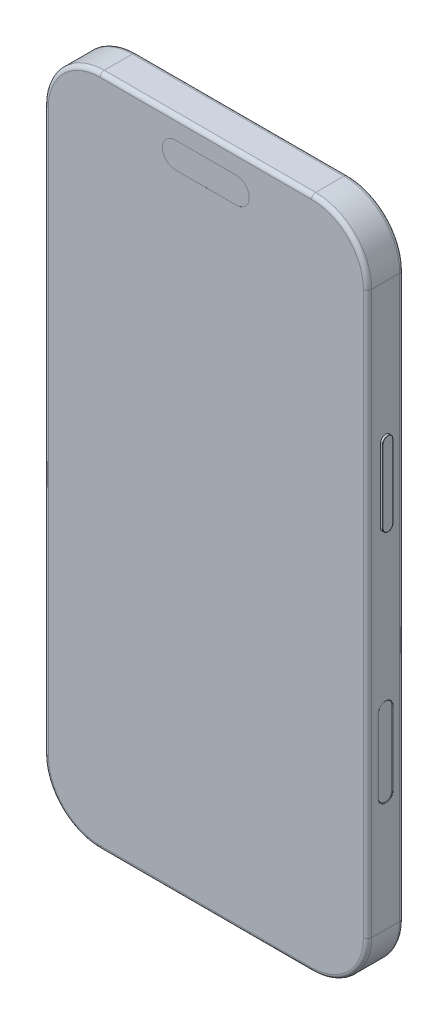
from build123d import *

# Parameters (mm, degrees)
BOSS_EXTRUDE1_DEPTH      = 4.375
FILLET1_R                = 1
CUT_EXTRUDE1_DEPTH       = 0.001
BOSS_EXTRUDE2_DEPTH      = 0.55
CUT_EXTRUDE2_DEPTH       = 0.1
FILLET2_R                = 0.2
FILLET3_R                = 0.1
BOSS_EXTRUDE4_DEPTH      = 0.6
FILLET4_R                = 0.1
SKETCH13_6_R             = 0.8
CUT_EXTRUDE3_DEPTH       = 5
CUT_EXTRUDE4_DEPTH       = 0.01
BOSS_EXTRUDE5_DEPTH      = 2.55
FILLET5_R                = 1.8
SKETCH16_R               = 7.8
BOSS_EXTRUDE6_DEPTH      = 2.2
FILLET6_R                = 0.5
CUT_EXTRUDE5_START       = -6.925
CUT_EXTRUDE5_OUTLINE_R   = 0.575
CUT_EXTRUDE5_DEPTH       = 5
CUT_EXTRUDE6_START       = -6.925
CUT_EXTRUDE6_OUTLINE_R   = 3.325
CUT_EXTRUDE6_OUTLINE_R_2 = 3.4
CUT_EXTRUDE6_DEPTH       = 0.01
SKETCH17_OUTSIDE_W       = 117.382
SKETCH17_OUTSIDE_H       = 200.632
SKETCH17_OUTSIDE_R       = 5.75
CUT_EXTRUDE7_DEPTH       = 0.01
CUT_EXTRUDE8_DEPTH       = 7
CUT_EXTRUDE9_START       = -81.2
CUT_EXTRUDE9_OUTLINE_R   = 0.575
CUT_EXTRUDE9_DEPTH       = 10
SKETCH20_R               = 0.865
CUT_EXTRUDE10_DEPTH      = 10


# Read off the part's stored shape, not the designer's step: Cut-Extrude5, Cut-Extrude6, Cut-Extrude9
with BuildPart() as part:
    # Sketch1 → Boss-Extrude1 (new, symmetric)
    with BuildSketch(Plane.XY):
        with BuildLine():
            Line((-25.5, 81.2), (25.5, 81.2))
            ThreePointArc((25.5, 81.2), (35.045941546, 77.245941546), (39, 67.7))
            Line((39, 67.7), (39, -67.7))
            ThreePointArc((39, -67.7), (35.045941546, -77.245941546), (25.5, -81.2))
            Line((25.5, -81.2), (-25.5, -81.2))
            ThreePointArc((-25.5, -81.2), (-35.045941546, -77.245941546), (-39, -67.7))
            Line((-39, -67.7), (-39, 67.7))
            ThreePointArc((-39, 67.7), (-35.045941546, 77.245941546), (-25.5, 81.2))
        make_face()
    extrude(amount=BOSS_EXTRUDE1_DEPTH, both=True)

    # Fillet1
    fillet1_edges = [part.edges().sort_by_distance(p)[0] for p in [
        (0, 81.2, -4.375),
        (35.045941546, 77.245941546, -4.375),
        (39, 0, -4.375),
        (35.045941546, -77.245941546, -4.375),
        (35.045941546, 77.245941546, 4.375),
        (0, 81.2, 4.375),
        (-35.045941546, 77.245941546, 4.375),
        (-39, 0, 4.375),
        (-35.045941546, -77.245941546, 4.375),
        (0, -81.2, 4.375),
        (35.045941546, -77.245941546, 4.375),
        (0, -81.2, -4.375),
        (39, 0, 4.375),
        (-35.045941546, -77.245941546, -4.375),
        (-39, 0, -4.375),
        (-35.045941546, 77.245941546, -4.375),
    ]]
    fillet(fillet1_edges, radius=FILLET1_R)

    # Sketch4 → Cut-Extrude1 (cut)
    with BuildSketch(Plane.XY.offset(4.375)):
        with BuildLine():
            Line((-7.345, 76.2), (7.345, 76.2))
            ThreePointArc((7.345, 76.2), (10.465, 73.08), (7.345, 69.96))
            Line((7.345, 69.96), (-7.345, 69.96))
            ThreePointArc((-7.345, 69.96), (-10.465, 73.08), (-7.345, 76.2))
        make_face()
    extrude(amount=-CUT_EXTRUDE1_DEPTH, mode=Mode.SUBTRACT)

    # Sketch7 → Boss-Extrude2 (add)
    with BuildSketch(Plane(origin=(39, 0, 0), x_dir=(0, 0, -1), z_dir=(1, 0, 0))):
        with BuildLine():
            Line((1.23, 34.52), (1.23, 16.82))
            ThreePointArc((1.23, 16.82), (0, 15.59), (-1.23, 16.82))
            Line((-1.23, 16.82), (-1.23, 34.52))
            ThreePointArc((-1.23, 34.52), (0, 35.75), (1.23, 34.52))
        make_face()
    extrude(amount=BOSS_EXTRUDE2_DEPTH)

    # Sketch7<3> → Cut-Extrude2 (cut)
    with BuildSketch(Plane(origin=(39, 0, 0), x_dir=(0, 0, -1), z_dir=(1, 0, 0))):
        with BuildLine():
            Line((1.665, -21.77), (1.665, -39.47))
            ThreePointArc((1.665, -39.47), (0, -41.135), (-1.665, -39.47))
            Line((-1.665, -39.47), (-1.665, -21.77))
            ThreePointArc((-1.665, -21.77), (0, -20.105), (1.665, -21.77))
        make_face()
    extrude(amount=-CUT_EXTRUDE2_DEPTH, mode=Mode.SUBTRACT)

    # Fillet2
    # the kernel refuses this fillet: 0.2 mm, written as the material it takes off along each edge
    with BuildSketch(Plane(origin=(39, -21.77, 0), x_dir=(0, 0, 1), z_dir=(0, -1, 0))) as fillet2_piece_1:
        with BuildLine():
            CenterArc((1.838205081, 0.2), FILLET2_R, 210, 60)
            Line((1.665, 0.1), (1.661535898, 0.098))
            ThreePointArc((1.661535898, 0.098), (1.661, 0.05), (1.661, 0))
            Line((1.661, 0), (1.665, -0.004))
            Line((1.665, -0.004), (1.838205081, -0.004))
            Line((1.838205081, -0.004), (1.838205081, 0))
        make_face()
    revolve(axis=Axis((39, -21.77, 0), (-1, 0, 0)), revolution_arc=180, mode=Mode.SUBTRACT)
    with BuildSketch(Plane(origin=(39, -39.47, 0), x_dir=(0, 0, -1), z_dir=(0, 1, 0))) as fillet2_piece_2:
        with BuildLine():
            CenterArc((1.838205081, 0.2), FILLET2_R, 210, 60)
            Line((1.665, 0.1), (1.661535898, 0.098))
            ThreePointArc((1.661535898, 0.098), (1.661, 0.05), (1.661, 0))
            Line((1.661, 0), (1.665, -0.004))
            Line((1.665, -0.004), (1.838205081, -0.004))
            Line((1.838205081, -0.004), (1.838205081, 0))
        make_face()
    revolve(axis=Axis((39, -39.47, 0), (-1, 0, 0)), revolution_arc=180, mode=Mode.SUBTRACT)
    with BuildSketch(Plane(origin=(39, -39.47, 1.665), x_dir=(0, 0, 1), z_dir=(0, 1, 0)), Plane(origin=(39, -21.77, -1.665), x_dir=(0, 0, -1), z_dir=(0, -1, 0))) as fillet2_piece_3:
        with BuildLine():
            CenterArc((0.173205081, -0.2), FILLET2_R, 90, 60)
            Line((0, -0.1), (-0.003464102, -0.098))
            ThreePointArc((-0.003464102, -0.098), (-0.004, -0.05), (-0.004, 0))
            Line((-0.004, 0), (0, 0.004))
            Line((0, 0.004), (0.173205081, 0.004))
            Line((0.173205081, 0.004), (0.173205081, 0))
        make_face()
    extrude(amount=17.7, mode=Mode.SUBTRACT)

    # Fillet3
    fillet3_edges = [part.edges().sort_by_distance(p)[0] for p in [
        (39.55, 25.67, -1.23),
        (39.55, 35.75, 0),
        (39.55, 25.67, 1.23),
        (39.55, 15.59, 0),
    ]]
    fillet(fillet3_edges, radius=FILLET3_R)

    # Sketch13 → Boss-Extrude4 (add)
    with BuildSketch(Plane.ZY.offset(39)):
        with BuildLine():
            Line((-1.33, 22.84), (-1.33, 14.3))
            ThreePointArc((-1.33, 14.3), (0, 12.97), (1.33, 14.3))
            Line((1.33, 14.3), (1.33, 22.84))
            ThreePointArc((1.33, 22.84), (0, 24.17), (-1.33, 22.84))
        make_face()
        with BuildLine():
            Line((-1.33, 40.43315417), (-1.33, 31.89315417))
            ThreePointArc((-1.33, 31.89315417), (0, 30.56315417), (1.33, 31.89315417))
            Line((1.33, 31.89315417), (1.33, 40.43315417))
            ThreePointArc((1.33, 40.43315417), (0, 41.76315417), (-1.33, 40.43315417))
        make_face()
        with BuildLine():
            Line((-1.33, 48.99), (-1.33, 44.85))
            ThreePointArc((-1.33, 44.85), (0, 43.52), (1.33, 44.85))
            Line((1.33, 44.85), (1.33, 48.99))
            ThreePointArc((1.33, 48.99), (0, 50.32), (-1.33, 48.99))
        make_face()
    extrude(amount=BOSS_EXTRUDE4_DEPTH)

    # Fillet4
    fillet4_edges = [part.edges().sort_by_distance(p)[0] for p in [
        (-39.6, 18.57, 1.33),
        (-39.6, 18.57, -1.33),
        (-39.6, 12.97, 0),
        (-39.6, 24.17, 0),
        (-39.6, 36.16315417, 1.33),
        (-39.6, 36.16315417, -1.33),
        (-39.6, 30.56315417, 0),
        (-39.6, 41.76315417, 0),
        (-39.6, 46.92, 1.33),
        (-39.6, 46.92, -1.33),
        (-39.6, 43.52, 0),
        (-39.6, 50.32, 0),
    ]]
    fillet(fillet4_edges, radius=FILLET4_R)

    # Sketch13<6> → Cut-Extrude3 (cut)
    with BuildSketch(Plane.ZY.offset(39)):
        with Locations(Location((0, -38.63, 0), (0, 0, 270))):
            Circle(SKETCH13_6_R)
    extrude(amount=-CUT_EXTRUDE3_DEPTH, mode=Mode.SUBTRACT)

    # Sketch14 → Cut-Extrude4 (cut)
    with BuildSketch(Plane(origin=(0, 0, -4.375), x_dir=(-1, 0, 0), z_dir=(0, 0, -1))):
        with BuildLine():
            Line((-23.08, 33.35), (23.08, 33.35))
            ThreePointArc((23.08, 33.35), (32.625941546, 29.395941546), (36.58, 19.85))
            Line((36.58, 19.85), (36.58, -64.45))
            ThreePointArc((36.58, -64.45), (32.625941546, -73.995941546), (23.08, -77.95))
            Line((23.08, -77.95), (-23.08, -77.95))
            ThreePointArc((-23.08, -77.95), (-32.625941546, -73.995941546), (-36.58, -64.45))
            Line((-36.58, -64.45), (-36.58, 19.85))
            ThreePointArc((-36.58, 19.85), (-32.625941546, 29.395941546), (-23.08, 33.35))
        make_face()
    extrude(amount=-CUT_EXTRUDE4_DEPTH, mode=Mode.SUBTRACT)

    # Sketch15 → Boss-Extrude5 (add)
    with BuildSketch(Plane(origin=(0, 0, -4.375), x_dir=(-1, 0, 0), z_dir=(0, 0, -1))):
        with BuildLine():
            Line((-24.25, 76.435), (24.25, 76.435))
            ThreePointArc((24.25, 76.435), (31.321067812, 73.506067812), (34.25, 66.435))
            Line((34.25, 66.435), (34.25, 47.565))
            ThreePointArc((34.25, 47.565), (31.321067812, 40.493932188), (24.25, 37.565))
            Line((24.25, 37.565), (-24.25, 37.565))
            ThreePointArc((-24.25, 37.565), (-31.321067812, 40.493932188), (-34.25, 47.565))
            Line((-34.25, 47.565), (-34.25, 66.435))
            ThreePointArc((-34.25, 66.435), (-31.321067812, 73.506067812), (-24.25, 76.435))
        make_face()
    extrude(amount=BOSS_EXTRUDE5_DEPTH)

    # Fillet5
    fillet5_edges = [part.edges().sort_by_distance(p)[0] for p in [
        (-31.321067812, 73.506067812, -4.375),
        (0, 76.435, -4.375),
        (31.321067812, 73.506067812, -4.375),
        (34.25, 57, -4.375),
        (31.321067812, 40.493932188, -4.375),
        (0, 37.565, -4.375),
        (-31.321067812, 40.493932188, -4.375),
        (-34.25, 57, -4.375),
    ]]
    fillet(fillet5_edges, radius=FILLET5_R)

    # Sketch16 → Boss-Extrude6 (add)
    with BuildSketch(Plane(origin=(0, 0, -6.925), x_dir=(-1, 0, 0), z_dir=(0, 0, -1))):
        with Locations(Location((-24.65, 66.57, 0), (0, 0, 180))):
            Circle(SKETCH16_R)
        with Locations(Location((-6.83, 56.8, 0), (0, 0, 180))):
            Circle(SKETCH16_R)
        with Locations(Location((-24.65, 47.77, 0), (0, 0, 180))):
            Circle(SKETCH16_R)
    extrude(amount=BOSS_EXTRUDE6_DEPTH)

    # Fillet6
    fillet6_edges = [part.edges().sort_by_distance(p)[0] for p in [
        (16.85, 47.77, -9.125),
        (-0.97, 56.8, -9.125),
        (16.85, 66.57, -9.125),
    ]]
    fillet(fillet6_edges, radius=FILLET6_R)

    # Cut-Extrude5 outline → Cut-Extrude5 (cut)
    with BuildSketch(Plane.XY.offset(CUT_EXTRUDE5_START)):
        with Locations((-24.7, 57.045)):
            Circle(CUT_EXTRUDE5_OUTLINE_R)
    extrude(amount=CUT_EXTRUDE5_DEPTH, mode=Mode.SUBTRACT)

    # Cut-Extrude6 outline → Cut-Extrude6 (cut)
    with BuildSketch(Plane.XY.offset(CUT_EXTRUDE6_START)):
        with Locations((-24.7, 47.13)):
            Circle(CUT_EXTRUDE6_OUTLINE_R)
        with Locations((-24.7, 66.96)):
            Circle(CUT_EXTRUDE6_OUTLINE_R_2)
    extrude(amount=CUT_EXTRUDE6_DEPTH, mode=Mode.SUBTRACT)

    # Sketch17 outside → Cut-Extrude7 (cut)
    with BuildSketch(Plane(origin=(0, 0, -9.125), x_dir=(-1, 0, 0), z_dir=(0, 0, -1))):
        with Locations((0.025, 0)):
            Rectangle(SKETCH17_OUTSIDE_W, SKETCH17_OUTSIDE_H)
        with Locations((-24.65, 66.57)):
            Circle(SKETCH17_OUTSIDE_R, mode=Mode.SUBTRACT)
        with Locations((-24.65, 47.77)):
            Circle(SKETCH17_OUTSIDE_R, mode=Mode.SUBTRACT)
        with Locations((-6.83, 56.8)):
            Circle(SKETCH17_OUTSIDE_R, mode=Mode.SUBTRACT)
    extrude(amount=-CUT_EXTRUDE7_DEPTH, mode=Mode.SUBTRACT)

    # Sketch18 → Cut-Extrude8 (cut)
    with BuildSketch(Plane.XZ.offset(81.2)):
        with BuildLine():
            Line((-4.5, -1.5), (4.5, -1.5))
            ThreePointArc((4.5, -1.5), (6, 0), (4.5, 1.5))
            Line((4.5, 1.5), (-4.5, 1.5))
            ThreePointArc((-4.5, 1.5), (-6, 0), (-4.5, -1.5))
        make_face()
    extrude(amount=-CUT_EXTRUDE8_DEPTH, mode=Mode.SUBTRACT)

    # Cut-Extrude9 outline → Cut-Extrude9 (cut)
    with BuildSketch(Plane(origin=(0, 0, 0), x_dir=(1, 0, 0), z_dir=(0, 1, 0)).offset(CUT_EXTRUDE9_START)):
        with Locations((7.5, 0)):
            Circle(CUT_EXTRUDE9_OUTLINE_R)
        with Locations((-7.5, 0)):
            Circle(CUT_EXTRUDE9_OUTLINE_R)
    extrude(amount=CUT_EXTRUDE9_DEPTH, mode=Mode.SUBTRACT)

    # Sketch20 → Cut-Extrude10 (cut)
    with BuildSketch(Plane.XZ.offset(81.2)):
        with Locations(Location((-23.59, 0, 0), (0, 0, 270))):
            Circle(SKETCH20_R)
        with Locations(Location((-21.19, 0, 0), (0, 0, 270))):
            Circle(SKETCH20_R)
        with Locations(Location((-18.79, 0, 0), (0, 0, 270))):
            Circle(SKETCH20_R)
        with Locations(Location((-16.39, 0, 0), (0, 0, 270))):
            Circle(SKETCH20_R)
        with Locations(Location((-13.99, 0, 0), (0, 0, 270))):
            Circle(SKETCH20_R)
        with Locations(Location((-11.59, 0, 0), (0, 0, 270))):
            Circle(SKETCH20_R)
        with Locations(Location((11.59, 0, 0), (0, 0, 90))):
            Circle(SKETCH20_R)
        with Locations(Location((13.99, 0, 0), (0, 0, 90))):
            Circle(SKETCH20_R)
        with Locations(Location((16.39, 0, 0), (0, 0, 90))):
            Circle(SKETCH20_R)
        with Locations(Location((18.79, 0, 0), (0, 0, 90))):
            Circle(SKETCH20_R)
        with Locations(Location((21.19, 0, 0), (0, 0, 90))):
            Circle(SKETCH20_R)
        with Locations(Location((23.59, 0, 0), (0, 0, 90))):
            Circle(SKETCH20_R)
    extrude(amount=-CUT_EXTRUDE10_DEPTH, mode=Mode.SUBTRACT)


solid = part.part
